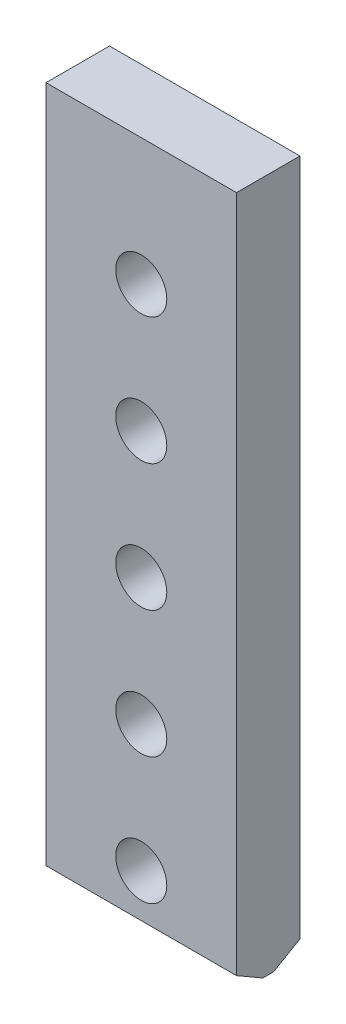
from build123d import *

# Parameters (mm, degrees)
SKETCH_1_W          = 75
SKETCH_1_H          = 273
EXTRUDE_1_DEPTH     = 25
SKETCH_2_R          = 10.05
CUT_EXTRUDE_1_DEPTH = 285.2164668
CHAMFER_1_SIZE      = 6
CHAMFER_1_SIZE2     = 10.392304845
CHAMFER_2_SIZE      = 6
CHAMFER_2_SIZE2     = 10.392304845


with BuildPart() as part:
    # Эскиз1 → Бобышка-Вытянуть1 (new body)
    with BuildSketch(Plane.XY):
        with Locations((37.5, 136.5)):
            Rectangle(SKETCH_1_W, SKETCH_1_H)
    extrude(amount=EXTRUDE_1_DEPTH)

    # Эскиз2 → Вырез-Вытянуть1 (cut, through all)
    with BuildSketch(Plane.XY.offset(25)):
        with Locations((37.5, 23)):
            Circle(SKETCH_2_R)
        with Locations((37.5, 73)):
            Circle(SKETCH_2_R)
        with Locations((37.5, 123)):
            Circle(SKETCH_2_R)
        with Locations((37.5, 173)):
            Circle(SKETCH_2_R)
        with Locations((37.5, 223)):
            Circle(SKETCH_2_R)
    extrude(amount=-CUT_EXTRUDE_1_DEPTH, mode=Mode.SUBTRACT)

    # Фаска1
    chamfer_1_edges = [part.edges().sort_by_distance(p)[0] for p in [
        (37.5, 0, 0),
    ]]
    chamfer_1_side = [part.faces().sort_by_distance(p)[0] for p in [
        (37.5, 137.633937976, 0),
    ]]
    chamfer(chamfer_1_edges, length=CHAMFER_1_SIZE, length2=CHAMFER_1_SIZE2, reference=chamfer_1_side[0])

    # Фаска2
    chamfer_2_edges = [part.edges().sort_by_distance(p)[0] for p in [
        (37.5, 0, 25),
    ]]
    chamfer_2_side = [part.faces().sort_by_distance(p)[0] for p in [
        (37.5, 137.633937976, 25),
    ]]
    chamfer(chamfer_2_edges, length=CHAMFER_2_SIZE, length2=CHAMFER_2_SIZE2, reference=chamfer_2_side[0])


solid = part.part
